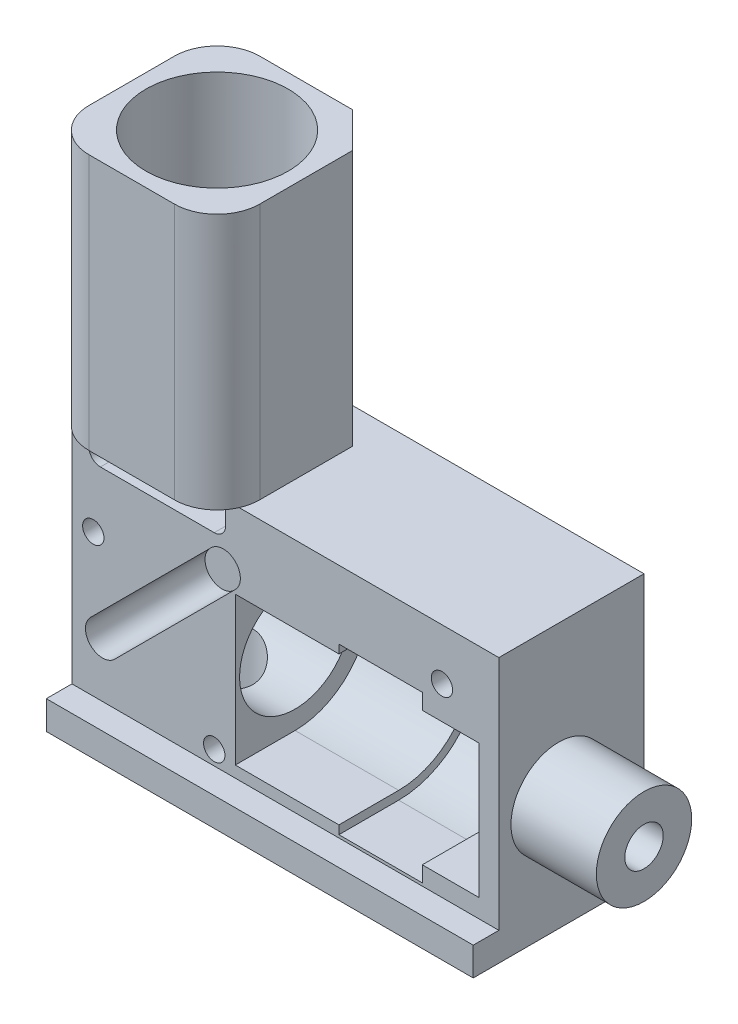
from build123d import *

# Parameters (mm, degrees)
SKETCH1_W                       = 15
SKETCH1_H                       = 6
MAIN_BODY_EXT_DEPTH             = 9.3
EMISSION_PATH_EXT_DEPTH         = 9
SKETCH3_R                       = 1.25
EMISSION_AND_GRIN_CUT_DEPTH     = 21.003499694
FIBER_FERRULE_CUT_REACH         = 25.851
FIBER_FERRULE_CUT_END_RADIUS    = 1.25
SKETCH4_R                       = 0.675
FIBER_START                     = 3
SKETCH41_R                      = 1.675
SKETCH41_R_2                    = 0.675
FIBER_FERRULE_PORT_EXT_DEPTH    = 3
SKETCH5_W                       = 15
SKETCH5_H                       = 8.3
FILTERSET_CUT1_DEPTH            = 0.9
FILTERSET_CUT2_DEPTH            = 4.2
SKETCH10_R                      = 2.5
EMISSION_LENS_CUT_DEPTH         = 8.5
EXCITATION_PATHWAY_CUT_REACH    = 24.231
SKETCH40_R                      = 1.95
EXCITATION_PATHWAY_CUT_2_DEPTH  = 2.1
SKETCH15_R                      = 0.795
MAGNETS_CUT_DEPTH               = 0.9
SCREW_HOLES_CUT_DEPTH           = 22.705989957
SCREW_HOLES_CUT_DEPTH_BACK      = 3
SKETCH18_R                      = 0.375
EXTERNAL_FILLET_1_R             = 1.5
EMISSION_PATHWAY_CUT_DEPTH      = 15.942891286
EMISSION_PATHWAY_CUT_DEPTH_BACK = 4
SKETCH28_R                      = 1.5
CUT_EXTRUDE16_DEPTH             = 9
CUT_EXTRUDE17_REACH             = 16.673
SKETCH37_R                      = 2
LENS_WALL_THICKNESS_EXT_DEPTH   = 6
BASEPLATE_NOTCH_CUT_DEPTH       = 22.386678096
BASEPLATE_NOTCH_CUT_DEPTH_BACK  = 2


with BuildPart() as part:
    # Sketch1 → Main Body Ext (new body)
    with BuildSketch(Plane(origin=(0, 0, 0), x_dir=(1, 0, 0), z_dir=(0, 1, 0))):
        Rectangle(SKETCH1_W, SKETCH1_H)
    extrude(amount=MAIN_BODY_EXT_DEPTH)

    # Sketch8 → Emission Path Ext (add)
    with BuildSketch(Plane(origin=(0, 9.3, 0), x_dir=(1, 0, 0), z_dir=(0, 1, 0))):
        Polygon((-2.75, 3), (-1.5, 1.75), (-1.5, -3), (-7.5, -3), (-7.5, 3), align=None)
    extrude(amount=EMISSION_PATH_EXT_DEPTH)

    # Sketch3 → Emission and Grin Cut (cut, through all)
    with BuildSketch(Plane.XZ):
        with Locations(Location((-4.5, 0, 0), (0, 0, 270))):
            Circle(SKETCH3_R)
    extrude(amount=-EMISSION_AND_GRIN_CUT_DEPTH, mode=Mode.SUBTRACT)

    # Fiber Ferrule Cut: up to this cylinder (the profile starts outside it)
    fiber_ferrule_cut_end = Plane(origin=(-4.5, 4, 0), z_dir=(0, -1, 0)) * Cylinder(FIBER_FERRULE_CUT_END_RADIUS, 55.202, mode=Mode.PRIVATE)
    # Sketch4 → Fiber Ferrule Cut (cut, up to the surface)
    with BuildSketch(Plane(origin=(7.5, 0, 0), x_dir=(0, 0, -1), z_dir=(1, 0, 0)), mode=Mode.PRIVATE) as fiber_ferrule_cut_sk1:
        with Locations((0, 4)):
            Circle(SKETCH4_R)
    fiber_ferrule_cut_tool1 = extrude(fiber_ferrule_cut_sk1.sketch, amount=-FIBER_FERRULE_CUT_REACH, mode=Mode.PRIVATE) - fiber_ferrule_cut_end
    add(fiber_ferrule_cut_tool1.solids().sort_by_distance((7.5, 4, 0))[0], mode=Mode.SUBTRACT)

    # Sketch41 → Fiber Ferrule Port Ext (add)
    with BuildSketch(Plane(origin=(7.5, 0, 0), x_dir=(0, 0, -1), z_dir=(1, 0, 0)).offset(FIBER_START)):
        with Locations(Location((0, 4, 0), (0, 0, 180))):
            Circle(SKETCH41_R)
        with Locations((0, 4)):
            Circle(SKETCH41_R_2, mode=Mode.SUBTRACT)
    extrude(amount=-FIBER_FERRULE_PORT_EXT_DEPTH)

    # Sketch5 → FilterSet Cut1 (cut)
    with BuildSketch(Plane.XY.offset(3)):
        with Locations((0, 5.15)):
            Rectangle(SKETCH5_W, SKETCH5_H)
    extrude(amount=-FILTERSET_CUT1_DEPTH, mode=Mode.SUBTRACT)

    # Sketch6 → FilterSet Cut2 (cut)
    with BuildSketch(Plane.XY.offset(2.1)):
        with BuildLine():
            Line((-2.60588745, 7.591168825), (-6.848528137, 3.348528137))
            ThreePointArc((-6.848528137, 3.348528137), (-6.848528137, 2.5), (-6, 2.5))
            Line((-6, 2.5), (-1.757359313, 6.742640687))
            ThreePointArc((-1.757359313, 6.742640687), (-1.757359313, 7.591168825), (-2.60588745, 7.591168825))
        make_face()
        with BuildLine():
            ThreePointArc((-6.5, 9.3), (-6.782842712, 9.182842712), (-6.9, 8.9))
            Line((-6.9, 8.9), (-6.9, 8.5))
            ThreePointArc((-6.9, 8.5), (-6.782842712, 8.217157288), (-6.5, 8.1))
            Line((-6.5, 8.1), (-2.5, 8.1))
            ThreePointArc((-2.5, 8.1), (-2.217157288, 8.217157288), (-2.1, 8.5))
            Line((-2.1, 8.5), (-2.1, 8.9))
            ThreePointArc((-2.1, 8.9), (-2.217157288, 9.182842712), (-2.5, 9.3))
            Line((-2.5, 9.3), (-6.5, 9.3))
        make_face()
    extrude(amount=-FILTERSET_CUT2_DEPTH, mode=Mode.SUBTRACT)

    # Sketch39 → Excitation Lens Cut (revolve, cut)
    with BuildSketch(Plane.XY, mode=Mode.PRIVATE) as excitation_lens_cut_sk:
        Polygon((0.6, 6.6), (1.88, 6.6), (1.88, 6.9), (3.4, 6.9), (4.81, 6.9), (4.81, 6.35), (6.81, 6.35), (6.81, 4), (4.81, 4), (3.4, 4), (-0.405829172, 4), (-0.9, 4), (-1.76, 4), (-1.76, 6.6), (-0.9, 6.6), align=None)
    revolve(excitation_lens_cut_sk.sketch.rotate(Axis((4.81, 4, 0), (-1, 0, 0)), 90), axis=Axis((4.81, 4, 0), (-1, 0, 0)), mode=Mode.SUBTRACT)

    # Sketch10 → Emission Lens Cut (cut)
    with BuildSketch(Plane(origin=(0, 18.3, 0), x_dir=(1, 0, 0), z_dir=(0, 1, 0))):
        with Locations(Location((-4.5, 0, 0), (0, 0, 270))):
            Circle(SKETCH10_R)
    extrude(amount=-EMISSION_LENS_CUT_DEPTH, mode=Mode.SUBTRACT)

    # Excitation Pathway Cut: up to this plane
    excitation_pathway_cut_end = Plane(origin=(-4.25, 4.25, -10.697056275), z_dir=(-0.7071067811865425, 0.7071067811865526, 0))
    # Sketch40 → Excitation Pathway Cut (cut, up to the surface)
    with BuildSketch(Plane(origin=(-1.76, 0, 0), x_dir=(0, 0, -1), z_dir=(1, 0, 0)), mode=Mode.PRIVATE) as excitation_pathway_cut_sk1:
        with Locations(Location((0, 4, 0), (0, 0, 90))):
            Circle(SKETCH40_R)
    excitation_pathway_cut_tool1 = split(extrude(excitation_pathway_cut_sk1.sketch, amount=-EXCITATION_PATHWAY_CUT_REACH, mode=Mode.PRIVATE), bisect_by=excitation_pathway_cut_end, keep=Keep.BOTH, mode=Mode.PRIVATE)
    add(excitation_pathway_cut_tool1.solids().sort_by_distance((-1.76, 4, 0))[0], mode=Mode.SUBTRACT)

    # Sketch44 → Excitation Pathway Cut 2 (cut)
    with BuildSketch(Plane.XY):
        Polygon((3.4, 1.1), (1.88, 1.1), (1.88, 1.4), (0.6, 1.4), (-0.9, 1.4), (-1.76, 1.4), (-1.76, 6.6), (-0.9, 6.6), (0.6, 6.6), (1.88, 6.6), (1.88, 6.9), (3.4, 6.9), (4.81, 6.9), (4.81, 6.35), (6.81, 6.35), (6.81, 1.65), (4.81, 1.65), (4.81, 1.1), align=None)
    extrude(amount=EXCITATION_PATHWAY_CUT_2_DEPTH, mode=Mode.SUBTRACT)

    # Sketch15 → Magnets Cut (cut)
    with BuildSketch(Plane.XZ):
        with Locations(Location((-6.25, -1.875, 0), (0, 0, 270))):
            Circle(SKETCH15_R)
        with Locations(Location((-6.25, 1.875, 0), (0, 0, 270))):
            Circle(SKETCH15_R)
        with Locations(Location((-1.5, 0, 0), (0, 0, 270))):
            Circle(SKETCH15_R)
    extrude(amount=-MAGNETS_CUT_DEPTH, mode=Mode.SUBTRACT)

    # Sketch18 → Screw Holes Cut (cut, two sides: drawn at the far end of the back side and taken through both)
    with BuildSketch(Plane.XY.offset(2.1).offset(-SCREW_HOLES_CUT_DEPTH_BACK)):
        with Locations(Location((-6.75, 6, 0), (0, 0, 180))):
            Circle(SKETCH18_R)
        with Locations(Location((5.5, 7.5, 0), (0, 0, 180))):
            Circle(SKETCH18_R)
        with Locations(Location((-2.5, 1.51, 0), (0, 0, 180))):
            Circle(SKETCH18_R)
    extrude(amount=SCREW_HOLES_CUT_DEPTH + SCREW_HOLES_CUT_DEPTH_BACK, mode=Mode.SUBTRACT)

    # External Fillet 1
    # the kernel refuses this fillet: 1.5 mm, written as the material it takes off along each edge
    with BuildSketch(Plane(origin=(-7.5, -3.75, -3), x_dir=(1, 0, 0), z_dir=(0, 1, 0))) as external_fillet_1_piece_1:
        with BuildLine():
            CenterArc((EXTERNAL_FILLET_1_R, -EXTERNAL_FILLET_1_R), EXTERNAL_FILLET_1_R, 90, 90)
            Line((0, -EXTERNAL_FILLET_1_R), (0, 0))
            Line((0, 0), (EXTERNAL_FILLET_1_R, 0))
        make_face()
    extrude(amount=25.8, mode=Mode.SUBTRACT)
    with BuildSketch(Plane(origin=(-1.5, 9.3, 3), x_dir=(0, 0, -1), z_dir=(0, 1, 0))) as external_fillet_1_piece_2:
        with BuildLine():
            CenterArc((EXTERNAL_FILLET_1_R, EXTERNAL_FILLET_1_R), EXTERNAL_FILLET_1_R, 180, 90)
            Line((0, EXTERNAL_FILLET_1_R), (0, 0))
            Line((0, 0), (EXTERNAL_FILLET_1_R, 0))
        make_face()
    extrude(amount=12.75, mode=Mode.SUBTRACT)

    # Sketch28 → Emission Pathway Cut (cut, two sides: drawn at the far end of the back side and taken through both)
    with BuildSketch(Plane(origin=(0, 8.1, 0), x_dir=(1, 0, 0), z_dir=(0, 1, 0)).offset(-EMISSION_PATHWAY_CUT_DEPTH_BACK)):
        with Locations(Location((-4.5, 0, 0), (0, 0, 180))):
            Circle(SKETCH28_R)
    extrude(amount=EMISSION_PATHWAY_CUT_DEPTH + EMISSION_PATHWAY_CUT_DEPTH_BACK, mode=Mode.SUBTRACT)

    # Sketch36 → Cut-Extrude16 (cut)
    with BuildSketch(Plane(origin=(0, 18.3, 0), x_dir=(1, 0, 0), z_dir=(0, 1, 0))):
        with BuildLine():
            Line((-7.5, -1.5), (-7.5, -3))
            Line((-7.5, -3), (-6, -3))
            ThreePointArc((-6, -3), (-7.060660172, -2.560660172), (-7.5, -1.5))
        make_face()
    extrude(amount=-CUT_EXTRUDE16_DEPTH, mode=Mode.SUBTRACT)

    # Sketch37 → Cut-Extrude17 (cut, up to next)
    with BuildSketch(Plane(origin=(0, 9.8, 0), x_dir=(1, 0, 0), z_dir=(0, 1, 0)), mode=Mode.PRIVATE) as cut_extrude17_sk1:
        with Locations(Location((-4.5, 0, 0), (0, 0, 180))):
            Circle(SKETCH37_R)
    cut_extrude17_tool1 = extrude(cut_extrude17_sk1.sketch, amount=-CUT_EXTRUDE17_REACH, mode=Mode.PRIVATE) & part.part
    add(cut_extrude17_tool1.solids().sort_by_distance((-4.5, 9.8, 0))[0], mode=Mode.SUBTRACT)

    # Sketch43 → Lens Wall Thickness Ext (add)
    with BuildSketch(Plane.ZY.offset(-5.81)):
        with BuildLine():
            Line((-3, 2.75), (-3, 5.25))
            Line((-3, 5.25), (-3, 5.802775638))
            ThreePointArc((-3, 5.802775638), (-3.5, 4), (-3, 2.197224362))
            Line((-3, 2.197224362), (-3, 2.75))
        make_face()
    extrude(amount=LENS_WALL_THICKNESS_EXT_DEPTH)

    # Sketch45 → Baseplate Notch Cut (cut, two sides: drawn at the far end of the back side and taken through both)
    with BuildSketch(Plane.XZ.offset(-BASEPLATE_NOTCH_CUT_DEPTH_BACK)):
        Polygon((30.47380128, 32.796887648), (7.5, -1.663902268), (6.609270453, -3), (-16.364530827, -37.460789916), (52.557049005, -83.408392475), (99.395381111, -13.150714911), align=None)
    extrude(amount=BASEPLATE_NOTCH_CUT_DEPTH + BASEPLATE_NOTCH_CUT_DEPTH_BACK, mode=Mode.SUBTRACT)


solid = part.part
